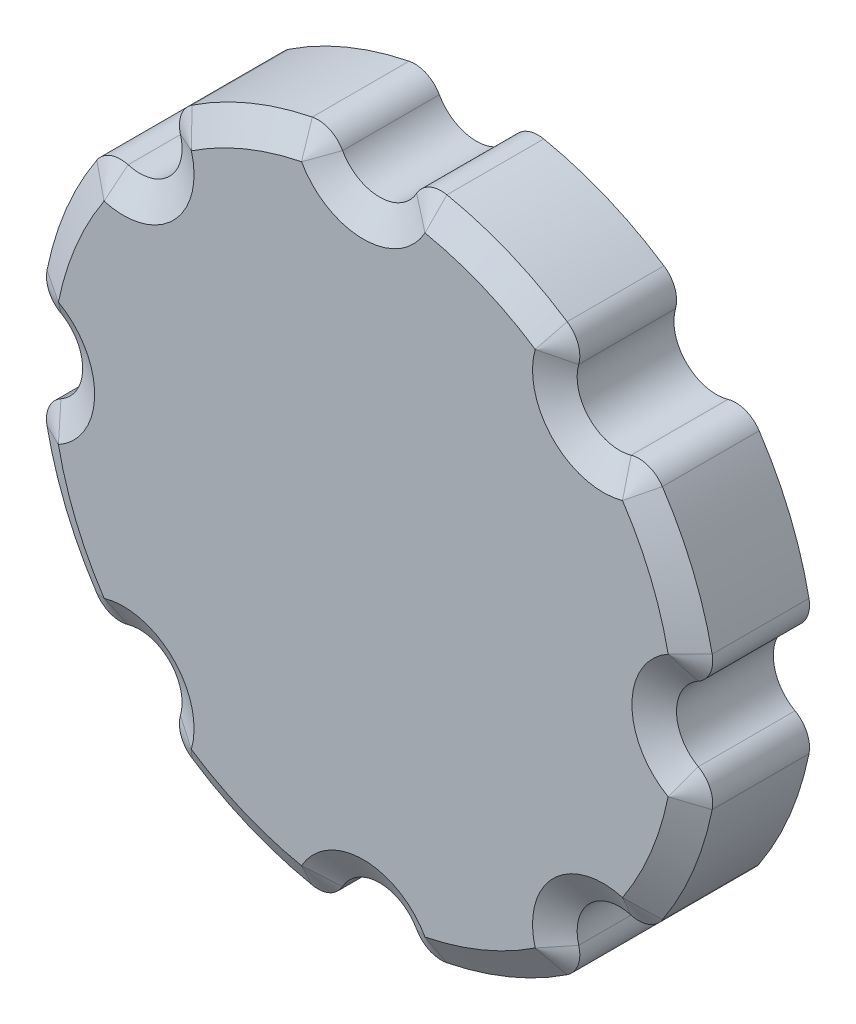
from build123d import *

# Parameters (mm, degrees)
SKETCH_1_R          = 2.75
SKETCH_1_R_2        = 1.5
EXTRUDE_1_DEPTH     = 1
SKETCH_2_R          = 6
EXTRUDE_2_DEPTH     = 2
SKETCH_3_R          = 0.75
CUT_EXTRUDE_1_DEPTH = 22
FILLET_1_R          = 0.5


with BuildPart() as part:
    # 草图1 → 凸台-拉伸1 (new body)
    with BuildSketch(Plane.XY):
        Circle(SKETCH_1_R)
        Circle(SKETCH_1_R_2, mode=Mode.SUBTRACT)
    extrude(amount=EXTRUDE_1_DEPTH)

    # 草图2 → 凸台-拉伸2 (add)
    with BuildSketch(Plane.XY.offset(1)):
        Circle(SKETCH_2_R)
    extrude(amount=EXTRUDE_2_DEPTH)

    # 草图3 → 切除-拉伸1 (cut)
    with BuildSketch(Plane.XY.offset(3)):
        with Locations((0, 6)):
            Circle(SKETCH_3_R)
        with Locations((4.242640687, 4.242640687)):
            Circle(SKETCH_3_R)
        with Locations((6, 0)):
            Circle(SKETCH_3_R)
        with Locations((4.242640687, -4.242640687)):
            Circle(SKETCH_3_R)
        with Locations((0, -6)):
            Circle(SKETCH_3_R)
        with Locations((-4.242640687, -4.242640687)):
            Circle(SKETCH_3_R)
        with Locations((-6, 0)):
            Circle(SKETCH_3_R)
        with Locations((-4.242640687, 4.242640687)):
            Circle(SKETCH_3_R)
    extrude(amount=-CUT_EXTRUDE_1_DEPTH, mode=Mode.SUBTRACT)

    # 圆角1
    fillet_1_edges = [part.edges().sort_by_distance(p)[0] for p in [
        (0.748533723, 5.953125, 2),
        (-0.748533723, 5.953125, 2),
        (4.738788328, 3.680201785, 2),
        (3.680201785, 4.738788328, 2),
        (5.953125, -0.748533723, 2),
        (5.953125, 0.748533723, 2),
        (3.680201785, -4.738788328, 2),
        (4.738788328, -3.680201785, 2),
        (-0.748533723, -5.953125, 2),
        (0.748533723, -5.953125, 2),
        (-4.738788328, -3.680201785, 2),
        (-3.680201785, -4.738788328, 2),
        (-5.953125, 0.748533723, 2),
        (-5.953125, -0.748533723, 2),
        (-3.680201785, 4.738788328, 2),
        (-4.738788328, 3.680201785, 2),
    ]]
    fillet(fillet_1_edges, radius=FILLET_1_R)

    # 倒角1
    # the kernel refuses this chamfer: 0.5, 0.288675135 mm, written as the material it takes off along each edge
    with BuildSketch(Plane(origin=(4.242640687, 4.242640687, 3), x_dir=(-0.9621057405727662, 0.27267662891588135, 0), z_dir=(0.27267662891588135, 0.9621057405727662, 0))) as chamfer_1_piece_1:
        with BuildLine():
            Line((1.267320508, 0.01), (0.732679492, -0.298675135))
            Line((0.732679492, -0.298675135), (0.722679492, -0.298675135))
            ThreePointArc((0.722679492, -0.298675135), (0.74, -0.149337567), (0.74, 0))
            Line((0.74, 0), (0.75, 0.01))
            ThreePointArc((0.75, 0.01), (1.008660254, 0.01), (1.267320508, 0.02))
            Line((1.267320508, 0.02), (1.267320508, 0.01))
        make_face()
    revolve(axis=Axis((4.242640687, 4.242640687, 3), (0, 0, 1)), revolution_arc=121.64720829, mode=Mode.SUBTRACT)
    with BuildSketch(Plane(origin=(0, 6, 3), x_dir=(-0.8731229867550157, -0.48750000000000077, 0), z_dir=(-0.48750000000000077, 0.8731229867550157, 0))) as chamfer_1_piece_2:
        with BuildLine():
            Line((1.267320508, 0.01), (0.732679492, -0.298675135))
            Line((0.732679492, -0.298675135), (0.722679492, -0.298675135))
            ThreePointArc((0.722679492, -0.298675135), (0.74, -0.149337567), (0.74, 0))
            Line((0.74, 0), (0.75, 0.01))
            ThreePointArc((0.75, 0.01), (1.008660254, 0.01), (1.267320508, 0.02))
            Line((1.267320508, 0.02), (1.267320508, 0.01))
        make_face()
    revolve(axis=Axis((0, 6, 3), (0, 0, 1)), revolution_arc=121.64720829, mode=Mode.SUBTRACT)
    with BuildSketch(Plane(origin=(0, 0, 3), x_dir=(-0.19843704244432184, 0.9801136363636364, 0), z_dir=(0.9801136363636364, 0.19843704244432184, 0))) as chamfer_1_piece_3:
        with BuildLine():
            Line((5.482679492, 0.01), (6.017320508, -0.298675135))
            Line((6.017320508, -0.298675135), (6.027320508, -0.298675135))
            ThreePointArc((6.027320508, -0.298675135), (6.01, -0.149337567), (6.01, 0))
            Line((6.01, 0), (6, 0.01))
            ThreePointArc((6, 0.01), (5.741339746, 0.01), (5.482679492, 0.02))
            Line((5.482679492, 0.02), (5.482679492, 0.01))
        make_face()
    revolve(axis=Axis((0, 0, 3), (0, 0, 1)), revolution_arc=22.108847212, mode=Mode.SUBTRACT)
    with BuildSketch(Plane(origin=(-4.242640687, 4.242640687, 3), x_dir=(0.9621057405727664, 0.27267662891588074, 0), z_dir=(-0.27267662891588074, 0.9621057405727664, 0))) as chamfer_1_piece_4:
        with BuildLine():
            Line((1.267320508, -0.01), (0.732679492, 0.298675135))
            Line((0.732679492, 0.298675135), (0.722679492, 0.298675135))
            ThreePointArc((0.722679492, 0.298675135), (0.74, 0.149337567), (0.74, 0))
            Line((0.74, 0), (0.75, -0.01))
            ThreePointArc((0.75, -0.01), (1.008660254, -0.01), (1.267320508, -0.02))
            Line((1.267320508, -0.02), (1.267320508, -0.01))
        make_face()
    revolve(axis=Axis((-4.242640687, 4.242640687, 3), (0, 0, -1)), revolution_arc=121.64720829, mode=Mode.SUBTRACT)
    with BuildSketch(Plane(origin=(0, 0, 3), x_dir=(-0.8333611769571161, 0.5527288202551504, 0), z_dir=(0.5527288202551504, 0.8333611769571161, 0))) as chamfer_1_piece_5:
        with BuildLine():
            Line((5.482679492, 0.01), (6.017320508, -0.298675135))
            Line((6.017320508, -0.298675135), (6.027320508, -0.298675135))
            ThreePointArc((6.027320508, -0.298675135), (6.01, -0.149337567), (6.01, 0))
            Line((6.01, 0), (6, 0.01))
            ThreePointArc((6, 0.01), (5.741339746, 0.01), (5.482679492, 0.02))
            Line((5.482679492, 0.02), (5.482679492, 0.01))
        make_face()
    revolve(axis=Axis((0, 0, 3), (0, 0, 1)), revolution_arc=22.108847212, mode=Mode.SUBTRACT)
    with BuildSketch(Plane(origin=(-6, 0, 3), x_dir=(0.48750000000000004, 0.873122986755016, 0), z_dir=(-0.873122986755016, 0.48750000000000004, 0))) as chamfer_1_piece_6:
        with BuildLine():
            Line((1.267320508, -0.01), (0.732679492, 0.298675135))
            Line((0.732679492, 0.298675135), (0.722679492, 0.298675135))
            ThreePointArc((0.722679492, 0.298675135), (0.74, 0.149337567), (0.74, 0))
            Line((0.74, 0), (0.75, -0.01))
            ThreePointArc((0.75, -0.01), (1.008660254, -0.01), (1.267320508, -0.02))
            Line((1.267320508, -0.02), (1.267320508, -0.01))
        make_face()
    revolve(axis=Axis((-6, 0, 3), (0, 0, -1)), revolution_arc=121.64720829, mode=Mode.SUBTRACT)
    with BuildSketch(Plane(origin=(0, 0, 3), x_dir=(-0.9801136363636364, -0.198437042444322, 0), z_dir=(-0.198437042444322, 0.9801136363636364, 0))) as chamfer_1_piece_7:
        with BuildLine():
            Line((5.482679492, 0.01), (6.017320508, -0.298675135))
            Line((6.017320508, -0.298675135), (6.027320508, -0.298675135))
            ThreePointArc((6.027320508, -0.298675135), (6.01, -0.149337567), (6.01, 0))
            Line((6.01, 0), (6, 0.01))
            ThreePointArc((6, 0.01), (5.741339746, 0.01), (5.482679492, 0.02))
            Line((5.482679492, 0.02), (5.482679492, 0.01))
        make_face()
    revolve(axis=Axis((0, 0, 3), (0, 0, 1)), revolution_arc=22.108847212, mode=Mode.SUBTRACT)
    with BuildSketch(Plane(origin=(-4.242640687, -4.242640687, 3), x_dir=(-0.27267662891588196, 0.962105740572766, 0), z_dir=(-0.962105740572766, -0.27267662891588196, 0))) as chamfer_1_piece_8:
        with BuildLine():
            Line((1.267320508, -0.01), (0.732679492, 0.298675135))
            Line((0.732679492, 0.298675135), (0.722679492, 0.298675135))
            ThreePointArc((0.722679492, 0.298675135), (0.74, 0.149337567), (0.74, 0))
            Line((0.74, 0), (0.75, -0.01))
            ThreePointArc((0.75, -0.01), (1.008660254, -0.01), (1.267320508, -0.02))
            Line((1.267320508, -0.02), (1.267320508, -0.01))
        make_face()
    revolve(axis=Axis((-4.242640687, -4.242640687, 3), (0, 0, -1)), revolution_arc=121.64720829, mode=Mode.SUBTRACT)
    with BuildSketch(Plane(origin=(0, 0, 3), x_dir=(-0.5527288202551508, -0.8333611769571158, 0), z_dir=(-0.8333611769571158, 0.5527288202551508, 0))) as chamfer_1_piece_9:
        with BuildLine():
            Line((5.482679492, 0.01), (6.017320508, -0.298675135))
            Line((6.017320508, -0.298675135), (6.027320508, -0.298675135))
            ThreePointArc((6.027320508, -0.298675135), (6.01, -0.149337567), (6.01, 0))
            Line((6.01, 0), (6, 0.01))
            ThreePointArc((6, 0.01), (5.741339746, 0.01), (5.482679492, 0.02))
            Line((5.482679492, 0.02), (5.482679492, 0.01))
        make_face()
    revolve(axis=Axis((0, 0, 3), (0, 0, 1)), revolution_arc=22.108847212, mode=Mode.SUBTRACT)
    with BuildSketch(Plane(origin=(0, -6, 3), x_dir=(0.8731229867550155, 0.48750000000000077, 0), z_dir=(0.48750000000000077, -0.8731229867550155, 0))) as chamfer_1_piece_10:
        with BuildLine():
            Line((1.267320508, 0.01), (0.732679492, -0.298675135))
            Line((0.732679492, -0.298675135), (0.722679492, -0.298675135))
            ThreePointArc((0.722679492, -0.298675135), (0.74, -0.149337567), (0.74, 0))
            Line((0.74, 0), (0.75, 0.01))
            ThreePointArc((0.75, 0.01), (1.008660254, 0.01), (1.267320508, 0.02))
            Line((1.267320508, 0.02), (1.267320508, 0.01))
        make_face()
    revolve(axis=Axis((0, -6, 3), (0, 0, 1)), revolution_arc=121.64720829, mode=Mode.SUBTRACT)
    with BuildSketch(Plane(origin=(0, 0, 3), x_dir=(0.1984370424443215, -0.9801136363636364, 0), z_dir=(-0.9801136363636364, -0.1984370424443215, 0))) as chamfer_1_piece_11:
        with BuildLine():
            Line((5.482679492, 0.01), (6.017320508, -0.298675135))
            Line((6.017320508, -0.298675135), (6.027320508, -0.298675135))
            ThreePointArc((6.027320508, -0.298675135), (6.01, -0.149337567), (6.01, 0))
            Line((6.01, 0), (6, 0.01))
            ThreePointArc((6, 0.01), (5.741339746, 0.01), (5.482679492, 0.02))
            Line((5.482679492, 0.02), (5.482679492, 0.01))
        make_face()
    revolve(axis=Axis((0, 0, 3), (0, 0, 1)), revolution_arc=22.108847212, mode=Mode.SUBTRACT)
    with BuildSketch(Plane(origin=(4.242640687, -4.242640687, 3), x_dir=(0.2726766289158815, 0.9621057405727662, 0), z_dir=(0.9621057405727662, -0.2726766289158815, 0))) as chamfer_1_piece_12:
        with BuildLine():
            Line((1.267320508, 0.01), (0.732679492, -0.298675135))
            Line((0.732679492, -0.298675135), (0.722679492, -0.298675135))
            ThreePointArc((0.722679492, -0.298675135), (0.74, -0.149337567), (0.74, 0))
            Line((0.74, 0), (0.75, 0.01))
            ThreePointArc((0.75, 0.01), (1.008660254, 0.01), (1.267320508, 0.02))
            Line((1.267320508, 0.02), (1.267320508, 0.01))
        make_face()
    revolve(axis=Axis((4.242640687, -4.242640687, 3), (0, 0, 1)), revolution_arc=121.64720829, mode=Mode.SUBTRACT)
    with BuildSketch(Plane(origin=(0, 0, 3), x_dir=(0.8333611769571158, -0.5527288202551508, 0), z_dir=(-0.5527288202551508, -0.8333611769571158, 0))) as chamfer_1_piece_13:
        with BuildLine():
            Line((5.482679492, 0.01), (6.017320508, -0.298675135))
            Line((6.017320508, -0.298675135), (6.027320508, -0.298675135))
            ThreePointArc((6.027320508, -0.298675135), (6.01, -0.149337567), (6.01, 0))
            Line((6.01, 0), (6, 0.01))
            ThreePointArc((6, 0.01), (5.741339746, 0.01), (5.482679492, 0.02))
            Line((5.482679492, 0.02), (5.482679492, 0.01))
        make_face()
    revolve(axis=Axis((0, 0, 3), (0, 0, 1)), revolution_arc=22.108847212, mode=Mode.SUBTRACT)
    with BuildSketch(Plane(origin=(6, 0, 3), x_dir=(-0.48750000000000004, 0.8731229867550161, 0), z_dir=(0.8731229867550161, 0.48750000000000004, 0))) as chamfer_1_piece_14:
        with BuildLine():
            Line((1.267320508, 0.01), (0.732679492, -0.298675135))
            Line((0.732679492, -0.298675135), (0.722679492, -0.298675135))
            ThreePointArc((0.722679492, -0.298675135), (0.74, -0.149337567), (0.74, 0))
            Line((0.74, 0), (0.75, 0.01))
            ThreePointArc((0.75, 0.01), (1.008660254, 0.01), (1.267320508, 0.02))
            Line((1.267320508, 0.02), (1.267320508, 0.01))
        make_face()
    revolve(axis=Axis((6, 0, 3), (0, 0, 1)), revolution_arc=121.64720829, mode=Mode.SUBTRACT)
    with BuildSketch(Plane(origin=(0, 0, 3), x_dir=(0.9801136363636362, 0.19843704244432203, 0), z_dir=(0.19843704244432203, -0.9801136363636362, 0))) as chamfer_1_piece_15:
        with BuildLine():
            Line((6.017320508, -0.298675135), (5.482679492, 0.01))
            Line((5.482679492, 0.01), (5.482679492, 0.02))
            ThreePointArc((5.482679492, 0.02), (5.741339746, 0.01), (6, 0.01))
            Line((6, 0.01), (6.01, 0))
            ThreePointArc((6.01, 0), (6.01, -0.149337567), (6.027320508, -0.298675135))
            Line((6.027320508, -0.298675135), (6.017320508, -0.298675135))
        make_face()
    revolve(axis=Axis((0, 0, 3), (0, 0, 1)), revolution_arc=22.108847212, mode=Mode.SUBTRACT)
    with BuildSketch(Plane(origin=(1.091403731, 5.390625004, 3), x_dir=(-0.873122989459575, 0.4874999951560769, 0), z_dir=(-0.4874999951560769, -0.873122989459575, 0))) as chamfer_1_piece_16:
        with BuildLine():
            Line((0, 2e-09), (0.517320503, 0.298675135))
            Line((0.517320503, 0.298675135), (0.527320503, 0.298675135))
            ThreePointArc((0.527320503, 0.298675135), (0.509999995, 0.149337567), (0.509999996, 0))
            Line((0.509999996, 0), (0.499999996, -0.01))
            Line((0.499999996, -0.01), (0, -0.019665188))
            Line((0, -0.019665188), (0, 2e-09))
        make_face()
    revolve(axis=Axis((1.091403731, 5.390625004, 3), (0, 0, -1)), revolution_arc=72.269181175, mode=Mode.SUBTRACT)
    with BuildSketch(Plane(origin=(-1.091403731, 5.390625004, 3), x_dir=(-0.19843704788178793, 0.9801136352627491, 0), z_dir=(-0.9801136352627491, -0.19843704788178793, 0))) as chamfer_1_piece_17:
        with BuildLine():
            Line((0, 2e-09), (0.517320503, 0.298675135))
            Line((0.517320503, 0.298675135), (0.527320503, 0.298675135))
            ThreePointArc((0.527320503, 0.298675135), (0.509999995, 0.149337567), (0.509999996, 0))
            Line((0.509999996, 0), (0.499999996, -0.01))
            Line((0.499999996, -0.01), (0, -0.019665188))
            Line((0, -0.019665188), (0, 2e-09))
        make_face()
    revolve(axis=Axis((-1.091403731, 5.390625004, 3), (0, 0, -1)), revolution_arc=72.269181175, mode=Mode.SUBTRACT)
    with BuildSketch(Plane(origin=(-3.040008516, 4.583486475, 3), x_dir=(-0.9621057390600083, -0.27267663425346006, 0), z_dir=(0.27267663425346006, -0.9621057390600083, 0))) as chamfer_1_piece_18:
        with BuildLine():
            Line((0, 2e-09), (0.517320503, 0.298675135))
            Line((0.517320503, 0.298675135), (0.527320503, 0.298675135))
            ThreePointArc((0.527320503, 0.298675135), (0.509999995, 0.149337567), (0.509999996, 0))
            Line((0.509999996, 0), (0.499999996, -0.01))
            Line((0.499999996, -0.01), (0, -0.019665188))
            Line((0, -0.019665188), (0, 2e-09))
        make_face()
    revolve(axis=Axis((-3.040008516, 4.583486475, 3), (0, 0, -1)), revolution_arc=72.269181175, mode=Mode.SUBTRACT)
    with BuildSketch(Plane(origin=(-4.583486475, 3.040008516, 3), x_dir=(-0.8333611800235503, 0.5527288156318211, 0), z_dir=(-0.5527288156318211, -0.8333611800235503, 0))) as chamfer_1_piece_19:
        with BuildLine():
            Line((0, 2e-09), (0.517320503, 0.298675135))
            Line((0.517320503, 0.298675135), (0.527320503, 0.298675135))
            ThreePointArc((0.527320503, 0.298675135), (0.509999995, 0.149337567), (0.509999996, 0))
            Line((0.509999996, 0), (0.499999996, -0.01))
            Line((0.499999996, -0.01), (0, -0.019665188))
            Line((0, -0.019665188), (0, 2e-09))
        make_face()
    revolve(axis=Axis((-4.583486475, 3.040008516, 3), (0, 0, -1)), revolution_arc=72.269181175, mode=Mode.SUBTRACT)
    with BuildSketch(Plane(origin=(-5.390625004, 1.091403731, 3), x_dir=(-0.48749999515608566, -0.8731229894595701, 0), z_dir=(0.8731229894595701, -0.48749999515608566, 0))) as chamfer_1_piece_20:
        with BuildLine():
            Line((0, 2e-09), (0.517320503, 0.298675135))
            Line((0.517320503, 0.298675135), (0.527320503, 0.298675135))
            ThreePointArc((0.527320503, 0.298675135), (0.509999995, 0.149337567), (0.509999996, 0))
            Line((0.509999996, 0), (0.499999996, -0.01))
            Line((0.499999996, -0.01), (0, -0.019665188))
            Line((0, -0.019665188), (0, 2e-09))
        make_face()
    revolve(axis=Axis((-5.390625004, 1.091403731, 3), (0, 0, -1)), revolution_arc=72.269181175, mode=Mode.SUBTRACT)
    with BuildSketch(Plane(origin=(-5.390625004, -1.091403731, 3), x_dir=(-0.9801136352627474, -0.19843704788179609, 0), z_dir=(0.19843704788179609, -0.9801136352627474, 0))) as chamfer_1_piece_21:
        with BuildLine():
            Line((0, 2e-09), (0.517320503, 0.298675135))
            Line((0.517320503, 0.298675135), (0.527320503, 0.298675135))
            ThreePointArc((0.527320503, 0.298675135), (0.509999995, 0.149337567), (0.509999996, 0))
            Line((0.509999996, 0), (0.499999996, -0.01))
            Line((0.499999996, -0.01), (0, -0.019665188))
            Line((0, -0.019665188), (0, 2e-09))
        make_face()
    revolve(axis=Axis((-5.390625004, -1.091403731, 3), (0, 0, -1)), revolution_arc=72.269181175, mode=Mode.SUBTRACT)
    with BuildSketch(Plane(origin=(-4.583486475, -3.040008516, 3), x_dir=(0.2726766342534678, -0.9621057390600061, 0), z_dir=(0.9621057390600061, 0.2726766342534678, 0))) as chamfer_1_piece_22:
        with BuildLine():
            Line((0, 2e-09), (0.517320503, 0.298675135))
            Line((0.517320503, 0.298675135), (0.527320503, 0.298675135))
            ThreePointArc((0.527320503, 0.298675135), (0.509999995, 0.149337567), (0.509999996, 0))
            Line((0.509999996, 0), (0.499999996, -0.01))
            Line((0.499999996, -0.01), (0, -0.019665188))
            Line((0, -0.019665188), (0, 2e-09))
        make_face()
    revolve(axis=Axis((-4.583486475, -3.040008516, 3), (0, 0, -1)), revolution_arc=72.269181175, mode=Mode.SUBTRACT)
    with BuildSketch(Plane(origin=(-3.040008516, -4.583486475, 3), x_dir=(-0.5527288156318109, -0.8333611800235572, 0), z_dir=(0.8333611800235572, -0.5527288156318109, 0))) as chamfer_1_piece_23:
        with BuildLine():
            Line((0, 2e-09), (0.517320503, 0.298675135))
            Line((0.517320503, 0.298675135), (0.527320503, 0.298675135))
            ThreePointArc((0.527320503, 0.298675135), (0.509999995, 0.149337567), (0.509999996, 0))
            Line((0.509999996, 0), (0.499999996, -0.01))
            Line((0.499999996, -0.01), (0, -0.019665188))
            Line((0, -0.019665188), (0, 2e-09))
        make_face()
    revolve(axis=Axis((-3.040008516, -4.583486475, 3), (0, 0, -1)), revolution_arc=72.269181175, mode=Mode.SUBTRACT)
    with BuildSketch(Plane(origin=(1.091403731, -5.390625004, 3), x_dir=(0.19843704788180544, -0.9801136352627454, 0), z_dir=(0.9801136352627454, 0.19843704788180544, 0))) as chamfer_1_piece_24:
        with BuildLine():
            Line((0, 2e-09), (0.517320503, 0.298675135))
            Line((0.517320503, 0.298675135), (0.527320503, 0.298675135))
            ThreePointArc((0.527320503, 0.298675135), (0.509999995, 0.149337567), (0.509999996, 0))
            Line((0.509999996, 0), (0.499999996, -0.01))
            Line((0.499999996, -0.01), (0, -0.019665188))
            Line((0, -0.019665188), (0, 2e-09))
        make_face()
    revolve(axis=Axis((1.091403731, -5.390625004, 3), (0, 0, -1)), revolution_arc=72.269181175, mode=Mode.SUBTRACT)
    with BuildSketch(Plane(origin=(-1.091403731, -5.390625004, 3), x_dir=(0.8731229894595748, -0.48749999515607717, 0), z_dir=(0.48749999515607717, 0.8731229894595748, 0))) as chamfer_1_piece_25:
        with BuildLine():
            Line((0, 2e-09), (0.517320503, 0.298675135))
            Line((0.517320503, 0.298675135), (0.527320503, 0.298675135))
            ThreePointArc((0.527320503, 0.298675135), (0.509999995, 0.149337567), (0.509999996, 0))
            Line((0.509999996, 0), (0.499999996, -0.01))
            Line((0.499999996, -0.01), (0, -0.019665188))
            Line((0, -0.019665188), (0, 2e-09))
        make_face()
    revolve(axis=Axis((-1.091403731, -5.390625004, 3), (0, 0, -1)), revolution_arc=72.269181175, mode=Mode.SUBTRACT)
    with BuildSketch(Plane(origin=(3.040008516, -4.583486475, 3), x_dir=(0.9621057390600103, 0.27267663425345307, 0), z_dir=(-0.27267663425345307, 0.9621057390600103, 0))) as chamfer_1_piece_26:
        with BuildLine():
            Line((0, 2e-09), (0.517320503, 0.298675135))
            Line((0.517320503, 0.298675135), (0.527320503, 0.298675135))
            ThreePointArc((0.527320503, 0.298675135), (0.509999995, 0.149337567), (0.509999996, 0))
            Line((0.509999996, 0), (0.499999996, -0.01))
            Line((0.499999996, -0.01), (0, -0.019665188))
            Line((0, -0.019665188), (0, 2e-09))
        make_face()
    revolve(axis=Axis((3.040008516, -4.583486475, 3), (0, 0, -1)), revolution_arc=72.269181175, mode=Mode.SUBTRACT)
    with BuildSketch(Plane(origin=(4.583486475, -3.040008516, 3), x_dir=(0.8333611800235367, -0.5527288156318417, 0), z_dir=(0.5527288156318417, 0.8333611800235367, 0))) as chamfer_1_piece_27:
        with BuildLine():
            Line((0, 2e-09), (0.517320503, 0.298675135))
            Line((0.517320503, 0.298675135), (0.527320503, 0.298675135))
            ThreePointArc((0.527320503, 0.298675135), (0.509999995, 0.149337567), (0.509999996, 0))
            Line((0.509999996, 0), (0.499999996, -0.01))
            Line((0.499999996, -0.01), (0, -0.019665188))
            Line((0, -0.019665188), (0, 2e-09))
        make_face()
    revolve(axis=Axis((4.583486475, -3.040008516, 3), (0, 0, -1)), revolution_arc=72.269181175, mode=Mode.SUBTRACT)
    with BuildSketch(Plane(origin=(5.390625004, 1.091403731, 3), x_dir=(0.9801136352627478, 0.1984370478817941, 0), z_dir=(-0.1984370478817941, 0.9801136352627478, 0))) as chamfer_1_piece_28:
        with BuildLine():
            Line((0.517320503, 0.298675135), (0, 2e-09))
            Line((0, 2e-09), (0, -0.019665188))
            Line((0, -0.019665188), (0.499999996, -0.01))
            Line((0.499999996, -0.01), (0.509999996, 0))
            ThreePointArc((0.509999996, 0), (0.509999995, 0.149337567), (0.527320503, 0.298675135))
            Line((0.527320503, 0.298675135), (0.517320503, 0.298675135))
        make_face()
    revolve(axis=Axis((5.390625004, 1.091403731, 3), (0, 0, -1)), revolution_arc=72.269181175, mode=Mode.SUBTRACT)
    with BuildSketch(Plane(origin=(5.390625004, -1.091403731, 3), x_dir=(0.4874999951560918, 0.8731229894595666, 0), z_dir=(-0.8731229894595666, 0.4874999951560918, 0))) as chamfer_1_piece_29:
        with BuildLine():
            Line((0, 2e-09), (0.517320503, 0.298675135))
            Line((0.517320503, 0.298675135), (0.527320503, 0.298675135))
            ThreePointArc((0.527320503, 0.298675135), (0.509999995, 0.149337567), (0.509999996, 0))
            Line((0.509999996, 0), (0.499999996, -0.01))
            Line((0.499999996, -0.01), (0, -0.019665188))
            Line((0, -0.019665188), (0, 2e-09))
        make_face()
    revolve(axis=Axis((5.390625004, -1.091403731, 3), (0, 0, -1)), revolution_arc=72.269181175, mode=Mode.SUBTRACT)
    with BuildSketch(Plane(origin=(4.583486475, 3.040008516, 3), x_dir=(0.833361180023539, 0.5527288156318383, 0), z_dir=(0.5527288156318383, -0.833361180023539, 0))) as chamfer_1_piece_30:
        with BuildLine():
            Line((0.517320503, -0.298675135), (0, -2e-09))
            Line((0, -2e-09), (0, 0.019665188))
            Line((0, 0.019665188), (0.499999996, 0.01))
            Line((0.499999996, 0.01), (0.509999996, 0))
            ThreePointArc((0.509999996, 0), (0.509999995, -0.149337567), (0.527320503, -0.298675135))
            Line((0.527320503, -0.298675135), (0.517320503, -0.298675135))
        make_face()
    revolve(axis=Axis((4.583486475, 3.040008516, 3), (0, 0, 1)), revolution_arc=72.269181175, mode=Mode.SUBTRACT)
    with BuildSketch(Plane(origin=(3.040008516, 4.583486475, 3), x_dir=(0.5527288156318306, 0.833361180023544, 0), z_dir=(-0.833361180023544, 0.5527288156318306, 0))) as chamfer_1_piece_31:
        with BuildLine():
            Line((0, 2e-09), (0.517320503, 0.298675135))
            Line((0.517320503, 0.298675135), (0.527320503, 0.298675135))
            ThreePointArc((0.527320503, 0.298675135), (0.509999995, 0.149337567), (0.509999996, 0))
            Line((0.509999996, 0), (0.499999996, -0.01))
            Line((0.499999996, -0.01), (0, -0.019665188))
            Line((0, -0.019665188), (0, 2e-09))
        make_face()
    revolve(axis=Axis((3.040008516, 4.583486475, 3), (0, 0, -1)), revolution_arc=72.269181175, mode=Mode.SUBTRACT)
    with BuildSketch(Plane(origin=(0, 0, 3), x_dir=(0.5527288202551502, 0.8333611769571161, 0), z_dir=(0.8333611769571161, -0.5527288202551502, 0))) as chamfer_1_piece_32:
        with BuildLine():
            Line((5.482679492, 0.01), (6.017320508, -0.298675135))
            Line((6.017320508, -0.298675135), (6.027320508, -0.298675135))
            ThreePointArc((6.027320508, -0.298675135), (6.01, -0.149337567), (6.01, 0))
            Line((6.01, 0), (6, 0.01))
            ThreePointArc((6, 0.01), (5.741339746, 0.01), (5.482679492, 0.02))
            Line((5.482679492, 0.02), (5.482679492, 0.01))
        make_face()
    revolve(axis=Axis((0, 0, 3), (0, 0, 1)), revolution_arc=22.108847212, mode=Mode.SUBTRACT)


solid = part.part
